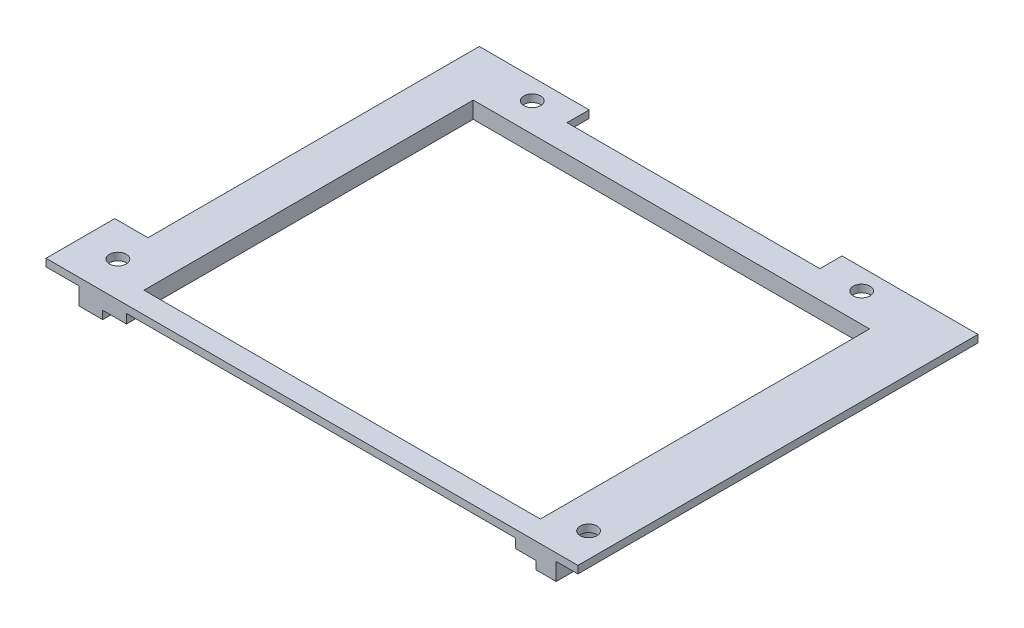
from build123d import *

# Parameters (mm, degrees)
SKETCH1_R             = 1.515
BOSS_EXTRUDE1_DEPTH   = 1.34
BOSS_EXTRUDE1_2_DEPTH = 1.34
SKETCH1_W             = 69.97
SKETCH1_H             = 3.84
BOSS_EXTRUDE1_3_DEPTH = 1.34
BOSS_EXTRUDE1_4_DEPTH = 1.34
BOSS_EXTRUDE2_DEPTH   = 3
BOSS_EXTRUDE3_DEPTH   = 4.47


with BuildPart() as part:
    # Sketch1 → Boss-Extrude1 (new body)
    with BuildSketch(Plane(origin=(0, 0, 0), x_dir=(1, 0, 0), z_dir=(0, 1, 0))):
        with BuildLine():
            Line((59.103409598, -39.481953668), (59.103409598, 32.478046332))
            Line((59.103409598, 32.478046332), (34.643409598, 32.478046332))
            Line((34.643409598, 32.478046332), (34.643409598, 28.498046332))
            Line((34.643409598, 28.498046332), (39.001477836, 28.498046332))
            ThreePointArc((39.001477836, 28.498046332), (41.888409598, 25.873046332), (44.775341361, 28.498046332))
            Line((44.775341361, 28.498046332), (55.203409598, 28.498046332))
            Line((55.203409598, 28.498046332), (55.203409598, -30.293048448))
            ThreePointArc((55.203409598, -30.293048448), (51.788409598, -33.146953668), (55.203409598, -36.000858887))
            Line((55.203409598, -36.000858887), (55.203409598, -39.481953668))
            Line((55.203409598, -39.481953668), (59.103409598, -39.481953668))
        make_face()
        with Locations((54.688409598, -33.146953668)):
            Circle(SKETCH1_R, mode=Mode.SUBTRACT)
        with Locations((41.888409598, 28.773046332)):
            Circle(SKETCH1_R, mode=Mode.SUBTRACT)
    extrude(amount=-BOSS_EXTRUDE1_DEPTH)



with BuildPart() as body_2:
    # Sketch1 → Boss-Extrude1 2 (new body)
    with BuildSketch(Plane(origin=(0, 0, 0), x_dir=(1, 0, 0), z_dir=(0, 1, 0))):
        with BuildLine():
            Line((-14.484658639, 28.498046332), (-10.836590402, 28.498046332))
            Line((-10.836590402, 28.498046332), (-10.836590402, 32.478046332))
            Line((-10.836590402, 32.478046332), (-30.596590402, 32.478046332))
            Line((-30.596590402, 32.478046332), (-30.596590402, 28.498046332))
            Line((-30.596590402, 28.498046332), (-20.258522164, 28.498046332))
            ThreePointArc((-20.258522164, 28.498046332), (-17.371590402, 25.873046332), (-14.484658639, 28.498046332))
        make_face()
        with Locations((-17.371590402, 28.773046332)):
            Circle(SKETCH1_R, mode=Mode.SUBTRACT)
    extrude(amount=-BOSS_EXTRUDE1_2_DEPTH)


with BuildPart() as body_3:
    # Sketch1 → Boss-Extrude1 3 (new body)
    with BuildSketch(Plane(origin=(0, 0, 0), x_dir=(1, 0, 0), z_dir=(0, 1, 0))):
        with Locations((12.898409598, -37.561953668)):
            Rectangle(SKETCH1_W, SKETCH1_H)
    extrude(amount=-BOSS_EXTRUDE1_3_DEPTH)

    # Sketch1<4> → Boss-Extrude2 (add)
    with BuildSketch(Plane(origin=(0, 0, 0), x_dir=(1, 0, 0), z_dir=(0, 1, 0))):
        with BuildLine():
            Line((47.883409598, -39.481953668), (51.553409598, -39.481953668))
            Line((51.553409598, -39.481953668), (51.553409598, 26.298046332))
            Line((51.553409598, 26.298046332), (43.399824498, 26.298046332))
            ThreePointArc((43.399824498, 26.298046332), (41.888409598, 25.873046332), (40.376994698, 26.298046332))
            Line((40.376994698, 26.298046332), (-15.860175502, 26.298046332))
            ThreePointArc((-15.860175502, 26.298046332), (-17.371590402, 25.873046332), (-18.883005302, 26.298046332))
            Line((-18.883005302, 26.298046332), (-26.376590402, 26.298046332))
            Line((-26.376590402, 26.298046332), (-26.376590402, -39.481953668))
            Line((-26.376590402, -39.481953668), (-22.086590402, -39.481953668))
            Line((-22.086590402, -39.481953668), (-22.086590402, -35.641953668))
            Line((-22.086590402, -35.641953668), (-22.786590402, -35.641953668))
            Line((-22.786590402, -35.641953668), (-22.786590402, 23.578046332))
            Line((-22.786590402, 23.578046332), (48.503409598, 23.578046332))
            Line((48.503409598, 23.578046332), (48.503409598, -35.641953668))
            Line((48.503409598, -35.641953668), (47.883409598, -35.641953668))
            Line((47.883409598, -35.641953668), (47.883409598, -39.481953668))
        make_face()
    extrude(amount=-BOSS_EXTRUDE2_DEPTH)


with BuildPart() as body_4:
    # Sketch1 → Boss-Extrude1 4 (new body)
    with BuildSketch(Plane(origin=(0, 0, 0), x_dir=(1, 0, 0), z_dir=(0, 1, 0))):
        with BuildLine():
            Line((-36.566590402, -39.481953668), (-30.596590402, -39.481953668))
            Line((-30.596590402, -39.481953668), (-30.596590402, -35.978803769))
            ThreePointArc((-30.596590402, -35.978803769), (-27.071590402, -33.146953668), (-30.596590402, -30.315103566))
            Line((-30.596590402, -30.315103566), (-30.596590402, -27.111953668))
            Line((-30.596590402, -27.111953668), (-36.566590402, -27.111953668))
            Line((-36.566590402, -27.111953668), (-36.566590402, -39.481953668))
        make_face()
        with Locations((-29.971590402, -33.146953668)):
            Circle(SKETCH1_R, mode=Mode.SUBTRACT)
    extrude(amount=-BOSS_EXTRUDE1_4_DEPTH)


with BuildPart() as part_1:
    add(part.part)

    add(body_2.part)  # Boss-Extrude3 merges body 2

    add(body_3.part)  # Boss-Extrude3 merges body 3

    add(body_4.part)  # Boss-Extrude3 merges body 4
    # Sketch1<6> → Boss-Extrude3 (add)
    with BuildSketch(Plane(origin=(0, 0, 0), x_dir=(1, 0, 0), z_dir=(0, 1, 0))):
        with BuildLine():
            Line((51.553409598, -39.481953668), (55.203409598, -39.481953668))
            Line((55.203409598, -39.481953668), (55.203409598, -36.000858887))
            ThreePointArc((55.203409598, -36.000858887), (51.788409598, -33.146953668), (55.203409598, -30.293048448))
            Line((55.203409598, -30.293048448), (55.203409598, 28.498046332))
            Line((55.203409598, 28.498046332), (44.775341361, 28.498046332))
            ThreePointArc((44.775341361, 28.498046332), (44.347345006, 27.235634007), (43.399824498, 26.298046332))
            Line((43.399824498, 26.298046332), (51.553409598, 26.298046332))
            Line((51.553409598, 26.298046332), (51.553409598, -39.481953668))
        make_face()
        with BuildLine():
            Line((39.001477836, 28.498046332), (-14.484658639, 28.498046332))
            ThreePointArc((-14.484658639, 28.498046332), (-14.912654994, 27.235634007), (-15.860175502, 26.298046332))
            Line((-15.860175502, 26.298046332), (40.376994698, 26.298046332))
            ThreePointArc((40.376994698, 26.298046332), (39.42947419, 27.235634007), (39.001477836, 28.498046332))
        make_face()
        with BuildLine():
            Line((-30.596590402, -39.481953668), (-26.376590402, -39.481953668))
            Line((-26.376590402, -39.481953668), (-26.376590402, 26.298046332))
            Line((-26.376590402, 26.298046332), (-18.883005302, 26.298046332))
            ThreePointArc((-18.883005302, 26.298046332), (-19.83052581, 27.235634007), (-20.258522164, 28.498046332))
            Line((-20.258522164, 28.498046332), (-30.596590402, 28.498046332))
            Line((-30.596590402, 28.498046332), (-30.596590402, -30.315103566))
            ThreePointArc((-30.596590402, -30.315103566), (-27.071590402, -33.146953668), (-30.596590402, -35.978803769))
            Line((-30.596590402, -35.978803769), (-30.596590402, -39.481953668))
        make_face()
    extrude(amount=-BOSS_EXTRUDE3_DEPTH)


solid = part_1.part
